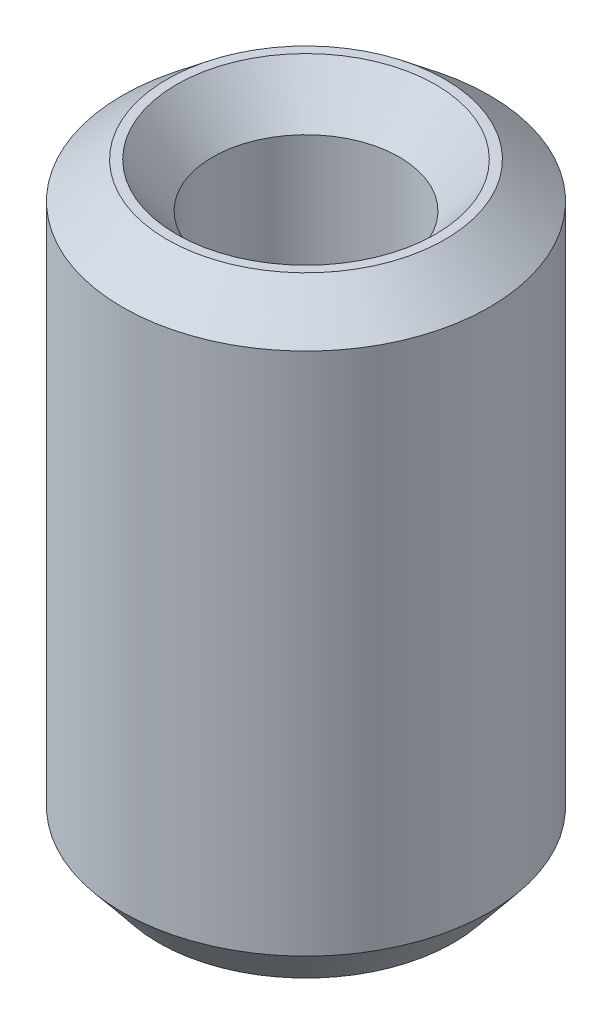
from build123d import *
from OCP.BRepFilletAPI import BRepFilletAPI_MakeChamfer

# Parameters (mm, degrees)
SKETCH1_R           = 7.5
BOSS_EXTRUDE1_DEPTH = 24.719692453
SKETCH2_R           = 3.814747852
CUT_EXTRUDE1_DEPTH  = 27.899130004
CHAMFER1_SIZE       = 1.482227285
CHAMFER1_SIZE2      = 1.822902548


with BuildPart() as part:
    # Sketch1 → Boss-Extrude1 (new body)
    with BuildSketch(Plane(origin=(0, 0, 0), x_dir=(1, 0, 0), z_dir=(0, 1, 0))):
        Circle(SKETCH1_R)
    extrude(amount=BOSS_EXTRUDE1_DEPTH)

    # Sketch2 → Cut-Extrude1 (cut, through all)
    with BuildSketch(Plane(origin=(0, 0, 0), x_dir=(1, 0, 0), z_dir=(0, 1, 0))):
        Circle(SKETCH2_R)
    extrude(amount=CUT_EXTRUDE1_DEPTH, mode=Mode.SUBTRACT)

    # Chamfer1: one chamfer whose edges measure the first distance from different faces: ONE call of the kernel's chamfer builder (chamfer() names one face for all edges)
    chamfer1_edges_1 = [part.edges().sort_by_distance(p)[0] for p in [
        (-3.814747852, 24.719692453, 0),
    ]]
    chamfer1_side_1 = [part.faces().sort_by_distance(p)[0] for p in [
        (-7.287867966, 24.719692453, 0),
    ]]
    chamfer1_edges_2 = [part.edges().sort_by_distance(p)[0] for p in [
        (-3.814747852, 0, 0),
    ]]
    chamfer1_side_2 = [part.faces().sort_by_distance(p)[0] for p in [
        (-3.814747852, 12.359846227, 0),
    ]]
    chamfer1_edges_3 = [part.edges().sort_by_distance(p)[0] for p in [
        (-7.5, 0, 0),
    ]]
    chamfer1_side_3 = [part.faces().sort_by_distance(p)[0] for p in [
        (-7.287867966, 0, 0),
    ]]
    chamfer1_edges_4 = [part.edges().sort_by_distance(p)[0] for p in [
        (-7.5, 24.719692453, 0),
    ]]
    chamfer1_side_4 = [part.faces().sort_by_distance(p)[0] for p in [
        (-7.5, 12.359846227, 0),
    ]]
    chamfer1 = BRepFilletAPI_MakeChamfer(part.part.solid().wrapped)
    for e in chamfer1_edges_1:
        chamfer1.Add(CHAMFER1_SIZE, CHAMFER1_SIZE2, e.wrapped, chamfer1_side_1[0].wrapped)  # the first distance lies on this face
    for e in chamfer1_edges_2:
        chamfer1.Add(CHAMFER1_SIZE, CHAMFER1_SIZE2, e.wrapped, chamfer1_side_2[0].wrapped)  # the first distance lies on this face
    for e in chamfer1_edges_3:
        chamfer1.Add(CHAMFER1_SIZE, CHAMFER1_SIZE2, e.wrapped, chamfer1_side_3[0].wrapped)  # the first distance lies on this face
    for e in chamfer1_edges_4:
        chamfer1.Add(CHAMFER1_SIZE, CHAMFER1_SIZE2, e.wrapped, chamfer1_side_4[0].wrapped)  # the first distance lies on this face
    add(Compound.cast(chamfer1.Shape()), mode=Mode.REPLACE)


solid = part.part
